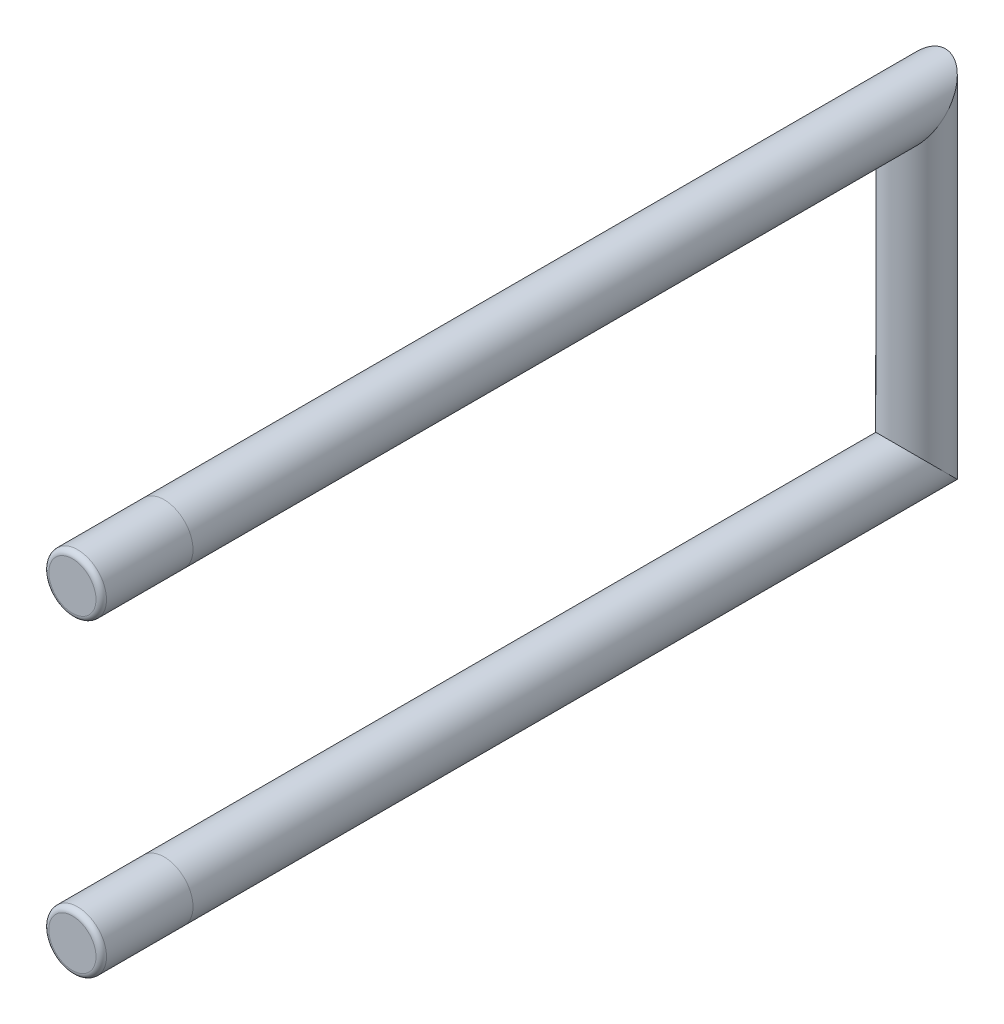
from build123d import *

# Parameters (mm, degrees)
SKETCH_1_R             = 11
EXTRUDE_1_DEPTH        = 287
SKETCH_2_R             = 11
EXTRUDE_2_DEPTH        = 118
PATTERN_LINEAR_1_COUNT = 2
PATTERN_LINEAR_1_PITCH = 118
CHAMFER_3_SIZE         = 21.999
SKETCH_3_R             = 10.9995
EXTRUDE_3_DEPTH        = 35
FILLET_1_R             = 2


with BuildPart() as part:
    # 草图1 → 拉伸1 (new body)
    with BuildSketch(Plane.XY):
        Circle(SKETCH_1_R)
    extrude_1 = extrude(amount=EXTRUDE_1_DEPTH)

    # 草图2 → 拉伸2 (add)
    with BuildSketch(Plane(origin=(0, 0, 0), x_dir=(1, 0, 0), z_dir=(0, 1, 0))):
        with Locations(Location((0, 0, 0), (0, 0, 180))):
            Circle(SKETCH_2_R)
    extrude(amount=EXTRUDE_2_DEPTH)

    # 阵列(线性)1: 拉伸1 ×2
    with Locations(*[(0, i * PATTERN_LINEAR_1_PITCH, 0) for i in range(1, PATTERN_LINEAR_1_COUNT)]):
        add(extrude_1)

    # 倒角3
    # the kernel refuses this chamfer: 21.999 mm, written as the material it adds along each edge
    with BuildSketch(Plane(origin=(67.574454052, 0, 0), x_dir=(0, -0.9996219169112966, 0.027495876610586372), z_dir=(-1, 0, 0))) as chamfer_3_piece_1_section:
        Polygon((CHAMFER_3_SIZE * 0.999621916911, -CHAMFER_3_SIZE * 0.0274958766106), (-CHAMFER_3_SIZE * 0.0274958766106, -CHAMFER_3_SIZE * 0.999621916911), (0, 0), align=None)
    chamfer_3_piece_1 = extrude(amount=135.148908105, mode=Mode.PRIVATE)
    chamfer_3_piece_1 = chamfer_3_piece_1 & Plane(origin=(0, 0, -4.859651136), x_dir=(1, 0, 0), z_dir=(0, 0, -1)) * Cylinder(11, 359, mode=Mode.PRIVATE)
    chamfer_3_piece_1 = chamfer_3_piece_1 & Plane(origin=(0, -4.859651136, 0), x_dir=(-1, 0, 0), z_dir=(0, -1, 0)) * Cylinder(11, 359, mode=Mode.PRIVATE)
    add(chamfer_3_piece_1)
    with BuildSketch(Plane(origin=(-67.574454052, 118, 0), x_dir=(0, -0.027495876610586358, -0.9996219169112966), z_dir=(1, 0, 0))) as chamfer_3_piece_2_section:
        Polygon((CHAMFER_3_SIZE * 0.999621916911, CHAMFER_3_SIZE * 0.0274958766106), (-CHAMFER_3_SIZE * 0.0274958766106, CHAMFER_3_SIZE * 0.999621916911), (0, 0), align=None)
    chamfer_3_piece_2 = extrude(amount=135.148908105, mode=Mode.PRIVATE)
    chamfer_3_piece_2 = chamfer_3_piece_2 & Plane(origin=(0, 122.859651136, 0), x_dir=(-1, 0, 0), z_dir=(0, -1, 0)) * Cylinder(11, 359, mode=Mode.PRIVATE)
    chamfer_3_piece_2 = chamfer_3_piece_2 & Plane(origin=(0, 118, -4.859651136), x_dir=(1, 0, 0), z_dir=(0, 0, -1)) * Cylinder(11, 359, mode=Mode.PRIVATE)
    add(chamfer_3_piece_2)

    # 草图3 → 拉伸3 (add)
    with BuildSketch(Plane.XY.offset(287)):
        with Locations((0, 118)):
            Circle(SKETCH_3_R)
        Circle(SKETCH_3_R)
    extrude(amount=EXTRUDE_3_DEPTH)

    # 圆角1
    fillet_1_edges = [part.edges().sort_by_distance(p)[0] for p in [
        (-10.9995, 118, 322),
        (-10.9995, 0, 322),
    ]]
    fillet(fillet_1_edges, radius=FILLET_1_R)


solid = part.part
